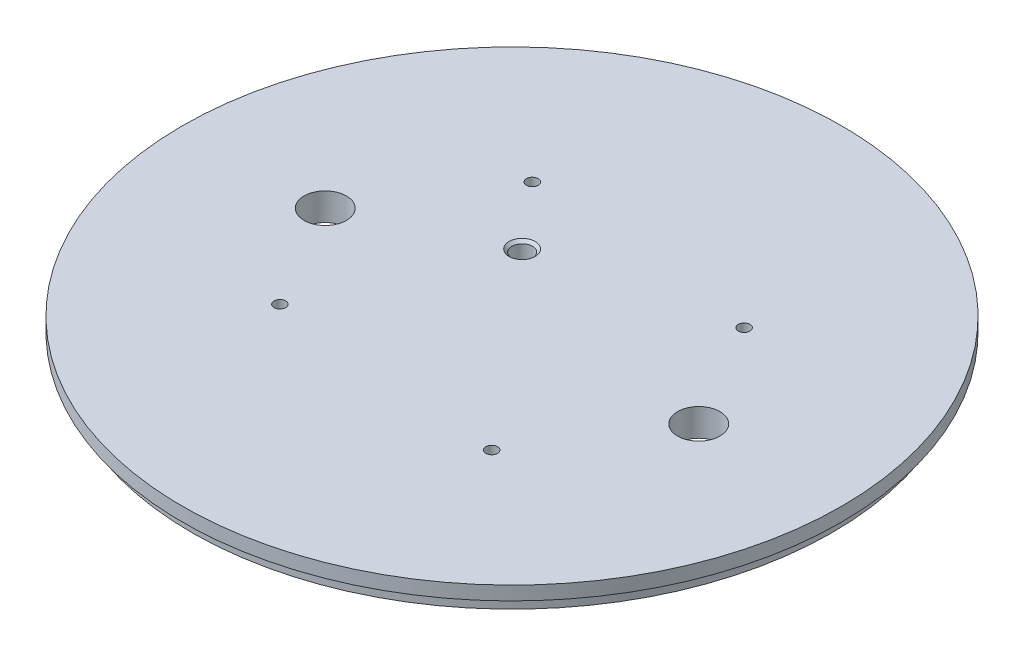
from build123d import *

# Parameters (mm, degrees)
SKETCH1_R                 = 76.2
BOSS_EXTRUDE1_DEPTH       = 6.35
TAP_DRILL_FOR_6_32_TAP1_D = 2.7051
CIRPATTERN1_COUNT         = 4
W_0_386_DIAMETER_HOLE1_D  = 9.8044
CUT_EXTRUDE4_DEPTH        = 3.175
SKETCH15_R                = 76.2
SKETCH15_R_2              = 74.041
CUT_EXTRUDE5_DEPTH        = 3.175
BODY_MOVE_COPY1_ANGLE     = 40


with BuildPart() as part:
    # Sketch1 → Boss-Extrude1 (new body)
    with BuildSketch(Plane(origin=(0, 0, 0), x_dir=(1, 0, 0), z_dir=(0, 1, 0))):
        Circle(SKETCH1_R)
    extrude(amount=BOSS_EXTRUDE1_DEPTH)

    # Tap Drill for #6-32 Tap1 (through all)
    with Locations(Plane(origin=(0, 0, 0), x_dir=(-1, 0, 0), z_dir=(0, -1, 0))):
        with Locations((37.52117539, 6.615995569)):
            tap_drill_for_6_32_tap1 = Hole(TAP_DRILL_FOR_6_32_TAP1_D / 2)

    # CirPattern1: Tap Drill for #6-32 Tap1 ×4 about axis
    cirpattern1_axis = Axis((0, 0, 0), (0, 1, 0))
    for i in range(1, CIRPATTERN1_COUNT):
        add(tap_drill_for_6_32_tap1.rotate(cirpattern1_axis, i * 360 / CIRPATTERN1_COUNT), mode=Mode.SUBTRACT)

    # W (0.386) Diameter Hole1 (through all)
    with Locations(Plane(origin=(0, 0, 0), x_dir=(-1, 0, 0), z_dir=(0, -1, 0))):
        with Locations((-33.077799054, 27.755568986), (33.077799054, -27.755568986)):
            Hole(W_0_386_DIAMETER_HOLE1_D / 2)

    # Sketch11 → 3/16 (0.1875) Diameter Hole1 (revolve, cut)
    with BuildSketch(Plane(origin=(-18.760587695, 0, -3.307997785), x_dir=(0, 0, -1), z_dir=(1, 0, 0))):
        Polygon((0, 0), (0, 6.35), (3.01625, 6.35), (2.38125, 5.715), (2.38125, 0.635), (3.01625, 0), align=None)
    revolve(axis=Axis((-18.760587695, -6.35, -3.307997785), (0, 1, 0)), mode=Mode.SUBTRACT)

    # Sketch12 → Cut-Extrude4 (cut)
    with BuildSketch(Plane.XZ):
        with BuildLine():
            Line((19.886888313, 28.738482206), (6.498907978, 12.783308544))
            ThreePointArc((6.498907978, 12.783308544), (6.898075233, 8.220805941), (11.460577836, 8.619973196))
            Line((11.460577836, 8.619973196), (24.848558171, 24.575146858))
            ThreePointArc((24.848558171, 24.575146858), (24.449390916, 29.137649461), (19.886888313, 28.738482206))
        make_face()
    cut_extrude4 = extrude(amount=-CUT_EXTRUDE4_DEPTH, mode=Mode.SUBTRACT)

    # Mirror1: Cut-Extrude4 across plane
    add(cut_extrude4.mirror(Plane(origin=(0, 0, 0), x_dir=(-0.7660444431189792, 0, 0.6427876096865378), z_dir=(0.6427876096865379, 0, 0.7660444431189792))), mode=Mode.SUBTRACT)

    # Sketch15 → Cut-Extrude5 (cut)
    with BuildSketch(Plane.XZ):
        Circle(SKETCH15_R)
        Circle(SKETCH15_R_2, mode=Mode.SUBTRACT)
    extrude(amount=-CUT_EXTRUDE5_DEPTH, mode=Mode.SUBTRACT)


with BuildPart() as part_1:
    # Body-Move/Copy1: moved
    add(part.part.rotate(Axis((0, 0, 0), (0, -1, 0)), BODY_MOVE_COPY1_ANGLE))


solid = part_1.part
